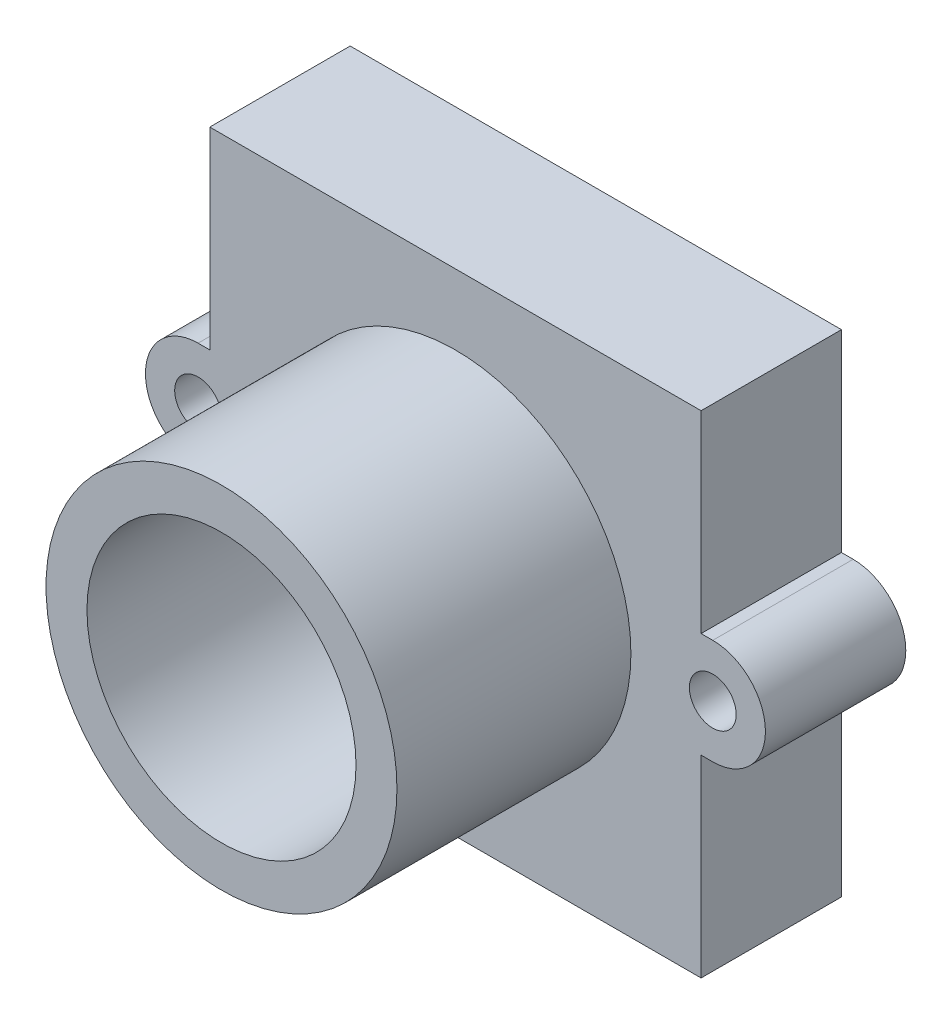
from build123d import *
from build123d.topology import SkipClean

# Parameters (mm, degrees)
BASE_HULL_DEPTH                   = 5
BASE_START                        = 1
BASE_COVER_DEPTH                  = 1
LENS_HOLE_HULL_BASE_SKETCH_R      = 7.5
LENS_HOLE_HULL_DEPTH              = 10
LENS_HOLE_D                       = 11.5
MOUNT_HOLES_D                     = 2
PULL_START                        = -5
PULL_BASE_TO_ORIGIN_OUTLINE_R     = 1
PULL_BASE_TO_ORIGIN_DEPTH         = 5
PULL_BASE_TO_ORIGIN_2_OUTLINE_R   = 5.75
PULL_BASE_TO_ORIGIN_2_DEPTH       = 5
PULL_START_2                      = 1
PULL_BASE_TO_ORIGIN_3_OUTLINE_R   = 1
PULL_BASE_TO_ORIGIN_3_DEPTH       = 5
PULL_START_3                      = 11
PULL_BASE_TO_ORIGIN_4_OUTLINE_R   = 7.5
PULL_BASE_TO_ORIGIN_4_OUTLINE_R_2 = 5.75
PULL_BASE_TO_ORIGIN_4_DEPTH       = 5
PULL_START_4                      = 5
PULL_BASE_TO_ORIGIN_5_OUTLINE_R   = 7.5
PULL_BASE_TO_ORIGIN_5_DEPTH       = 1


# Read off the part's stored shape, not the designer's step: Pull base to origin
with BuildPart() as part:
    # Base sketch → Base hull (new body)
    with BuildSketch(Plane.XY):
        with BuildLine():
            Line((-10.5, 10.5), (10.5, 10.5))
            Line((10.5, 10.5), (10.5, 2.25))
            Line((10.5, 2.25), (11, 2.25))
            ThreePointArc((11, 2.25), (13.25, 0), (11, -2.25))
            Line((11, -2.25), (10.5, -2.25))
            Line((10.5, -2.25), (10.5, -10.5))
            Line((10.5, -10.5), (-10.5, -10.5))
            Line((-10.5, -10.5), (-10.5, -2.25))
            Line((-10.5, -2.25), (-11, -2.25))
            ThreePointArc((-11, -2.25), (-13.25, 0), (-11, 2.25))
            Line((-11, 2.25), (-10.5, 2.25))
            Line((-10.5, 2.25), (-10.5, 10.5))
        make_face()
        Polygon((-9, 6.485638508), (-9, -6.485638508), (-6.485638508, -9), (6.485638508, -9), (9, -6.485638508), (9, 6.485638508), (6.485638508, 9), (-6.485638508, 9), align=None, mode=Mode.SUBTRACT)
    extrude(amount=-BASE_HULL_DEPTH)

    # Base sketch<2> → Base cover (add)
    # profile 1 of 2: a face of its own
    with BuildSketch(Plane.XY.offset(BASE_START)):
        with BuildLine():
            ThreePointArc((11, 2.25), (13.25, 0), (11, -2.25))
            Line((11, -2.25), (10.5, -2.25))
            Line((10.5, -2.25), (10.5, -10.5))
            Line((10.5, -10.5), (-10.5, -10.5))
            Line((-10.5, -10.5), (-10.5, -2.25))
            Line((-10.5, -2.25), (-11, -2.25))
            ThreePointArc((-11, -2.25), (-13.25, 0), (-11, 2.25))
            Line((-11, 2.25), (-10.5, 2.25))
            Line((-10.5, 2.25), (-10.5, 10.5))
            Line((-10.5, 10.5), (10.5, 10.5))
            Line((10.5, 10.5), (10.5, 2.25))
            Line((10.5, 2.25), (11, 2.25))
        make_face()
        Polygon((-6.485638508, 9), (-9, 6.485638508), (-9, -6.485638508), (-6.485638508, -9), (6.485638508, -9), (9, -6.485638508), (9, 6.485638508), (6.485638508, 9), align=None, mode=Mode.SUBTRACT)
    # profile 2 of 2: a face of its own
    with BuildSketch(Plane.XY.offset(BASE_START)):
        Polygon((6.485638508, 9), (-6.485638508, 9), (-9, 6.485638508), (-9, -6.485638508), (-6.485638508, -9), (6.485638508, -9), (9, -6.485638508), (9, 6.485638508), align=None)
    extrude(amount=-BASE_COVER_DEPTH)

    # Lens hole hull base sketch → Lens hole hull (add)
    with BuildSketch(Plane.XY.offset(1)):
        Circle(LENS_HOLE_HULL_BASE_SKETCH_R)
    extrude(amount=LENS_HOLE_HULL_DEPTH)

    # Lens hole (through all)
    with Locations(Plane.XY.offset(11)):
        with Locations((0, 0)):
            Hole(LENS_HOLE_D / 2)

    # Mount holes (through all)
    with Locations(Plane.XY.offset(1)):
        with Locations((-11, 0), (11, 0)):
            Hole(MOUNT_HOLES_D / 2)

    # Pull base to origin outline → Pull base to origin (cut)
    with BuildSketch(Plane.XY.offset(PULL_START)):
        with BuildLine():
            Line((10.5, 10.5), (-10.5, 10.5))
            Line((-10.5, 10.5), (-10.5, 2.25))
            Line((-10.5, 2.25), (-11, 2.25))
            ThreePointArc((-11, 2.25), (-13.25, 0), (-11, -2.25))
            Line((-11, -2.25), (-10.5, -2.25))
            Line((-10.5, -2.25), (-10.5, -10.5))
            Line((-10.5, -10.5), (10.5, -10.5))
            Line((10.5, -10.5), (10.5, -2.25))
            Line((10.5, -2.25), (11, -2.25))
            ThreePointArc((11, -2.25), (13.25, 0), (11, 2.25))
            Line((11, 2.25), (10.5, 2.25))
            Line((10.5, 2.25), (10.5, 10.5))
        make_face()
        with Locations((-11, 0)):
            Circle(PULL_BASE_TO_ORIGIN_OUTLINE_R, mode=Mode.SUBTRACT)
        Polygon((6.485638508, -9), (-6.485638508, -9), (-9, -6.485638508), (-9, 6.485638508), (-6.485638508, 9), (6.485638508, 9), (9, 6.485638508), (9, -6.485638508), align=None, mode=Mode.SUBTRACT)
        with Locations((11, 0)):
            Circle(PULL_BASE_TO_ORIGIN_OUTLINE_R, mode=Mode.SUBTRACT)
    extrude(amount=PULL_BASE_TO_ORIGIN_DEPTH, mode=Mode.SUBTRACT)

    # Pull base to origin 2 outline → Pull base to origin 2 (cut)
    with BuildSketch(Plane.XY):
        Polygon((-9, -6.485638508), (-6.485638508, -9), (6.485638508, -9), (9, -6.485638508), (9, 6.485638508), (6.485638508, 9), (-6.485638508, 9), (-9, 6.485638508), align=None)
        Circle(PULL_BASE_TO_ORIGIN_2_OUTLINE_R, mode=Mode.SUBTRACT)
    extrude(amount=PULL_BASE_TO_ORIGIN_2_DEPTH, mode=Mode.SUBTRACT)

    # Pull base to origin 3 outline → Pull base to origin 3 (add)
    with SkipClean():  # the faces are left unmerged after this step: merging them gives an invalid solid
        with BuildSketch(Plane.XY.offset(PULL_START_2)):
            with BuildLine():
                Line((10.5, 10.5), (-10.5, 10.5))
                Line((-10.5, 10.5), (-10.5, 2.25))
                Line((-10.5, 2.25), (-11, 2.25))
                ThreePointArc((-11, 2.25), (-13.25, 0), (-11, -2.25))
                Line((-11, -2.25), (-10.5, -2.25))
                Line((-10.5, -2.25), (-10.5, -10.5))
                Line((-10.5, -10.5), (10.5, -10.5))
                Line((10.5, -10.5), (10.5, -2.25))
                Line((10.5, -2.25), (11, -2.25))
                ThreePointArc((11, -2.25), (13.25, 0), (11, 2.25))
                Line((11, 2.25), (10.5, 2.25))
                Line((10.5, 2.25), (10.5, 10.5))
            make_face()
            with Locations((-11, 0)):
                Circle(PULL_BASE_TO_ORIGIN_3_OUTLINE_R, mode=Mode.SUBTRACT)
            Polygon((6.485638508, -9), (-6.485638508, -9), (-9, -6.485638508), (-9, 6.485638508), (-6.485638508, 9), (6.485638508, 9), (9, 6.485638508), (9, -6.485638508), align=None, mode=Mode.SUBTRACT)
            with Locations((11, 0)):
                Circle(PULL_BASE_TO_ORIGIN_3_OUTLINE_R, mode=Mode.SUBTRACT)
        extrude(amount=PULL_BASE_TO_ORIGIN_3_DEPTH)
    add(part.part.scale(1), mode=Mode.REPLACE)  # the faces are merged on a copy

    # Pull base to origin 4 outline → Pull base to origin 4 (add)
    with SkipClean():  # the faces are left unmerged after this step: merging them gives an invalid solid
        with BuildSketch(Plane.XY.offset(PULL_START_3)):
            Circle(PULL_BASE_TO_ORIGIN_4_OUTLINE_R)
            Circle(PULL_BASE_TO_ORIGIN_4_OUTLINE_R_2, mode=Mode.SUBTRACT)
        extrude(amount=PULL_BASE_TO_ORIGIN_4_DEPTH)

    # Pull base to origin 5 outline → Pull base to origin 5 (add)
    with SkipClean():  # the faces are left unmerged after this step: merging them gives an invalid solid
        with BuildSketch(Plane.XY.offset(PULL_START_4)):
            Polygon((-9, -6.485638508), (-6.485638508, -9), (6.485638508, -9), (9, -6.485638508), (9, 6.485638508), (6.485638508, 9), (-6.485638508, 9), (-9, 6.485638508), align=None)
            Circle(PULL_BASE_TO_ORIGIN_5_OUTLINE_R, mode=Mode.SUBTRACT)
        extrude(amount=PULL_BASE_TO_ORIGIN_5_DEPTH)


solid = part.part
